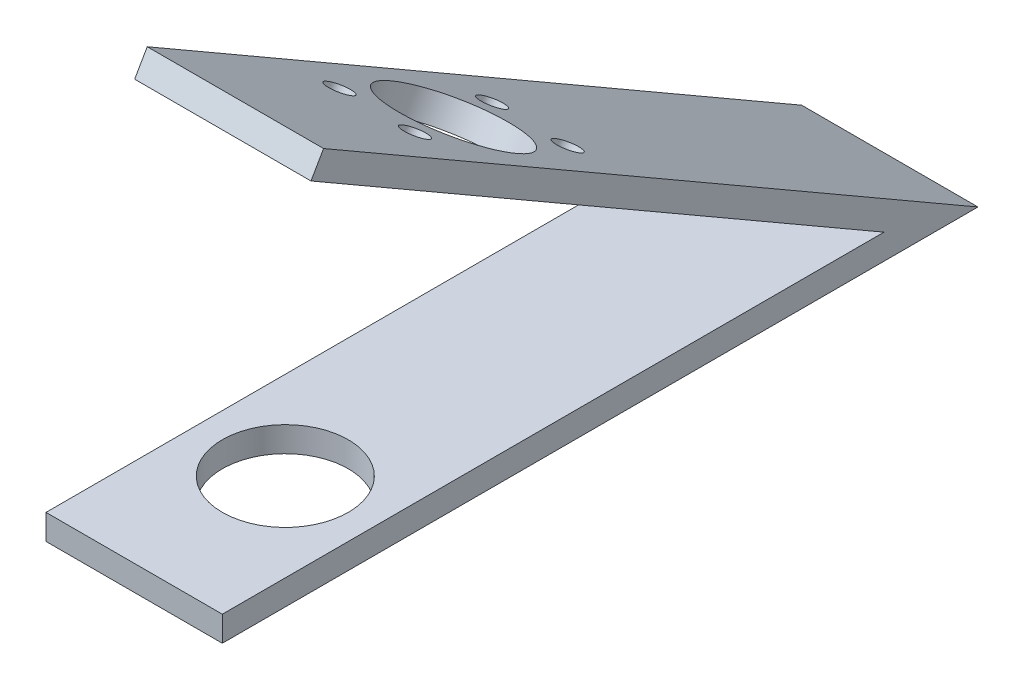
from build123d import *

# Parameters (mm, degrees)
BOSS_EXTRUDE1_DEPTH = 70
SKETCH2_R           = 25
CUT_EXTRUDE1_DEPTH  = 10
SKETCH5_R           = 25
CUT_EXTRUDE3_DEPTH  = 300
SKETCH6_R           = 5
CUT_EXTRUDE5_DEPTH  = 10


with BuildPart() as part:
    # Sketch1 → Boss-Extrude1 (new body)
    with BuildSketch(Plane(origin=(0, 0, 0), x_dir=(0, 0, -1), z_dir=(1, 0, 0))):
        Polygon((-227.48711306, 131.339745962), (0, 0), (-262.679491924, 0), (-262.679491924, -10), (37.320508076, -10), (-222.48711306, 140), align=None)
    extrude(amount=BOSS_EXTRUDE1_DEPTH)

    # Sketch2 → Cut-Extrude1 (cut)
    with BuildSketch(Plane(origin=(0, 8.660254038, -5), x_dir=(1, 0, 0), z_dir=(0, 0.8660254037844418, -0.49999999999999445))):
        with Locations((35, -162.679491924)):
            Circle(SKETCH2_R)
    extrude(amount=-CUT_EXTRUDE1_DEPTH, mode=Mode.SUBTRACT)

    # Sketch5 → Cut-Extrude3 (cut)
    with BuildSketch(Plane(origin=(0, 0, 0), x_dir=(1, 0, 0), z_dir=(0, 1, 0))):
        with Locations((35, -202.679491924)):
            Circle(SKETCH5_R)
    extrude(amount=-CUT_EXTRUDE3_DEPTH, mode=Mode.SUBTRACT)

    # Sketch6 → Cut-Extrude5 (cut)
    with BuildSketch(Plane(origin=(0, 8.660254038, -5), x_dir=(1, 0, 0), z_dir=(0, 0.8660254037844416, -0.49999999999999484))):
        with Locations((50, -197.679491924)):
            Circle(SKETCH6_R)
        with Locations((20, -197.679491924)):
            Circle(SKETCH6_R)
        with Locations((20, -127.679491924)):
            Circle(SKETCH6_R)
        with Locations((50, -127.679491924)):
            Circle(SKETCH6_R)
    extrude(amount=-CUT_EXTRUDE5_DEPTH, mode=Mode.SUBTRACT)


solid = part.part
